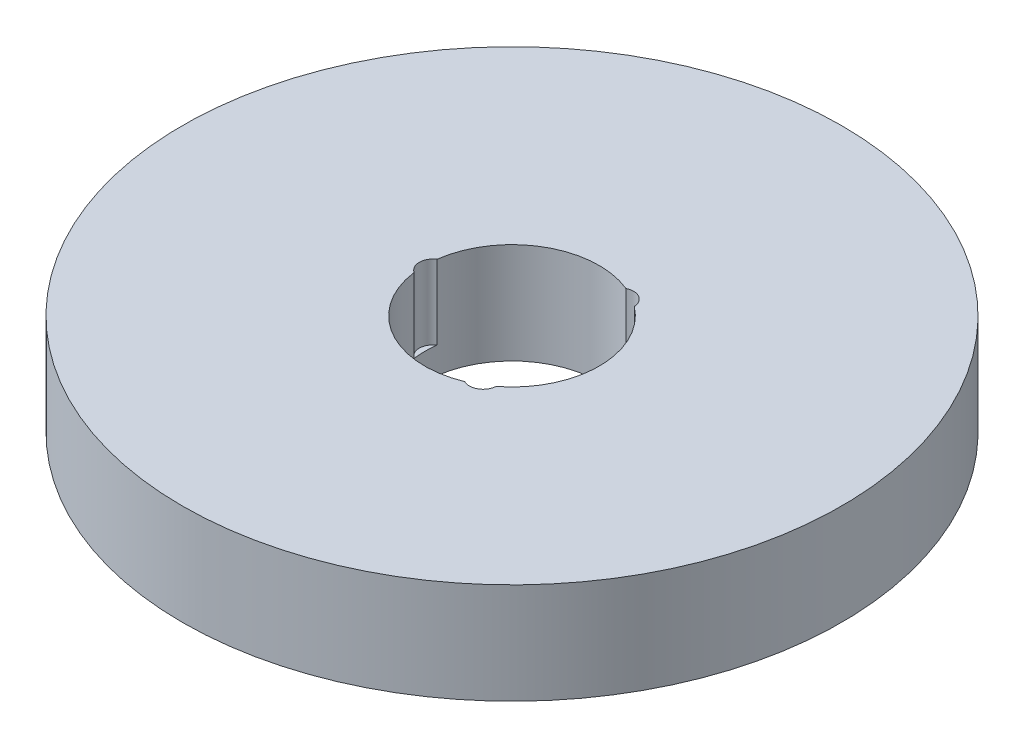
from build123d import *

# Parameters (mm, degrees)
SKETCH1_R           = 85
BOSS_EXTRUDE1_DEPTH = 26
SKETCH2_R           = 22.5
CUT_EXTRUDE1_DEPTH  = 123.987804273
SKETCH3_R           = 3.519996011
CUT_EXTRUDE2_DEPTH  = 19.183627962
CIRPATTERN1_COUNT   = 3


with BuildPart() as part:
    # Sketch1 → Boss-Extrude1 (new body)
    with BuildSketch(Plane(origin=(0, 0, 0), x_dir=(1, 0, 0), z_dir=(0, 1, 0))):
        Circle(SKETCH1_R)
    extrude(amount=BOSS_EXTRUDE1_DEPTH)

    # Sketch2 → Cut-Extrude1 (cut, through all)
    with BuildSketch(Plane(origin=(0, 0, 0), x_dir=(1, 0, 0), z_dir=(0, 1, 0))):
        Circle(SKETCH2_R)
    extrude(amount=CUT_EXTRUDE1_DEPTH, mode=Mode.SUBTRACT)

    # Sketch3 → Cut-Extrude2 (cut)
    with BuildSketch(Plane(origin=(0, 26, 0), x_dir=(1, 0, 0), z_dir=(0, 1, 0))):
        with Locations((-20.385612989, 0)):
            Circle(SKETCH3_R)
    cut_extrude2 = extrude(amount=-CUT_EXTRUDE2_DEPTH, mode=Mode.SUBTRACT)

    # CirPattern1: Cut-Extrude2 ×3 about axis
    cirpattern1_axis = Axis((0, 0, 0), (0, 1, 0))
    for i in range(1, CIRPATTERN1_COUNT):
        add(cut_extrude2.rotate(cirpattern1_axis, i * 360 / CIRPATTERN1_COUNT), mode=Mode.SUBTRACT)


solid = part.part
